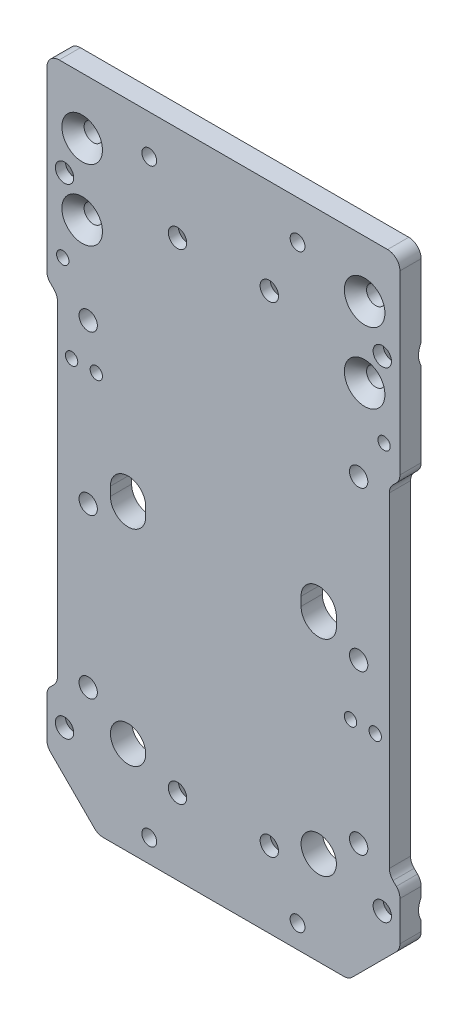
from build123d import *

# Parameters (mm, degrees)
BODY_DEPTH                                 = 3
REDUCESOMEWIDTH_DEPTH                      = 178.302002245
SCREWHEADHOLECARRIAGEY_R                   = 5
CUTFOROTHERSCREWSHEADS_DEPTH               = 178.302002245
ENDMILLMINIMUMRADIUS_R                     = 3.5
F_3_5_3_5_CABLETIEHOLES_D                  = 3.5
F_4_2_4_2_KP8_HOLES1_D                     = 4.2
F_4_2_4_2_KP8_HOLES2_D                     = 4.2
F_4_2_4_2_KP8_HOLES2_CSINK_D               = 9.6
F_4_2_4_2_KP8_HOLES2_CSINK_ANGLE           = 90
F_5_2_5_2_MOUNTANGLECORNERHOLES_AT_2_COUNT = 2
F_5_2_5_2_MOUNTANGLECORNERHOLES_AT_2_PITCH = 20
F_5_2_5_2_MOUNTANGLECORNERHOLES_AT_3_COUNT = 2
F_5_2_5_2_MOUNTANGLECORNERHOLES_AT_3_PITCH = 80
F_5_2_5_2_MOUNTANGLECORNERHOLES_AT_4_COUNT = 2
F_5_2_5_2_MOUNTANGLECORNERHOLES_AT_4_PITCH = 82.462112512
F_5_2_5_2_SK8_MOUNT_HOLES_D                = 5.2
F_5_2_5_2_SK8_MOUNT_HOLES_CSINK_D          = 11.5
F_5_2_5_2_SK8_MOUNT_HOLES_CSINK_ANGLE      = 90
F_3_5_3_5_ENDSENSORSHOLES_D                = 3.5
F_3_5_3_5_ENDSENSORSHOLES_CSINK_D          = 6.5
F_3_5_3_5_ENDSENSORSHOLES_CSINK_ANGLE      = 90
F_5_2_5_2_MOUNTTOBASEHOLES_D               = 5.2


with BuildPart() as part:
    # Sketch1 → Body (new, symmetric)
    with BuildSketch(Plane.XY):
        Polygon((35.5, -14.5), (50, 0), (50, 170), (-50, 170), (-50, 0), (-35.5, -14.5), align=None)
    extrude(amount=BODY_DEPTH, both=True)

    # Sketch6 → ReduceSomeWidth (cut, through all)
    with BuildSketch(Plane.XY.offset(3)):
        Polygon((-50, 115), (-47, 112), (-47, 17), (-50, 14), align=None)
        Polygon((50, 115), (47, 112), (47, 17), (50, 14), align=None)
    extrude(amount=-REDUCESOMEWIDTH_DEPTH, mode=Mode.SUBTRACT)

    # screwHeadHoleCarriageY → CutForOtherScrewsHeads (cut, through all)
    with BuildSketch(Plane(origin=(0, 0, -3), x_dir=(-1, 0, 0), z_dir=(0, 0, -1))):
        with Locations((-27, 12)):
            Circle(SCREWHEADHOLECARRIAGEY_R)
        with Locations((27, 12)):
            Circle(SCREWHEADHOLECARRIAGEY_R)
        with BuildLine():
            Line((-32, 70.2), (-32, 72.7))
            ThreePointArc((-32, 72.7), (-27, 77.7), (-22, 72.7))
            Line((-22, 72.7), (-22, 70.2))
            ThreePointArc((-22, 70.2), (-27, 65.2), (-32, 70.2))
        make_face()
        with BuildLine():
            Line((22, 70.2), (22, 72.7))
            ThreePointArc((22, 72.7), (27, 77.7), (32, 72.7))
            Line((32, 72.7), (32, 70.2))
            ThreePointArc((32, 70.2), (27, 65.2), (22, 70.2))
        make_face()
    extrude(amount=-CUTFOROTHERSCREWSHEADS_DEPTH, mode=Mode.SUBTRACT)

    # EndMillMinimumRadius
    endmillminimumradius_edges = [part.edges().sort_by_distance(p)[0] for p in [
        (-50, 170, 0),
        (50, 170, 0),
        (47, 112, 0),
        (47, 17, 0),
        (-47, 17, 0),
        (-47, 112, 0),
        (-50, 14, 0),
        (-50, 0, 0),
        (-35.5, -14.5, 0),
        (50, 14, 0),
        (50, 0, 0),
        (35.5, -14.5, 0),
        (-50, 115, 0),
        (50, 115, 0),
    ]]
    fillet(endmillminimumradius_edges, radius=ENDMILLMINIMUMRADIUS_R)

    # Ø3.5 (3.5) CableTieHoles (through all)
    with Locations(Plane(origin=(0, 0, -3), x_dir=(-1, 0, 0), z_dir=(0, 0, -1))):
        with Locations((-45.5, 122), (45.5, 122)):
            Hole(F_3_5_3_5_CABLETIEHOLES_D / 2)

    # Ø4.2 (4.2) KP8 Holes1 (through all)
    with Locations(Plane(origin=(0, 0, -3), x_dir=(-1, 0, 0), z_dir=(0, 0, -1))):
        with Locations((-21, 159), (21, 159)):
            Hole(F_4_2_4_2_KP8_HOLES1_D / 2)

    # Ø4.2 (4.2) KP8 Holes2 (through all)
    with Locations(Plane(origin=(0, 0, -3), x_dir=(-1, 0, 0), z_dir=(0, 0, -1))):
        with Locations((-21, -8), (21, -8)):
            CounterSinkHole(F_4_2_4_2_KP8_HOLES2_D / 2, F_4_2_4_2_KP8_HOLES2_CSINK_D / 2, counter_sink_angle=F_4_2_4_2_KP8_HOLES2_CSINK_ANGLE)

    # Sketch16 → Ø5.2 (5.2) MountAngleCornerHoles (revolve, cut)
    with BuildSketch(Plane(origin=(40, 154, -3), x_dir=(0, 1, 0), z_dir=(1, 0, 0))):
        Polygon((0, 0), (0, 6), (5.75, 6), (2.6, 2.85), (2.6, 0), align=None)
    f_5_2_5_2_mountanglecornerholes = revolve(axis=Axis((40, 154, -9.35), (0, 0, 1)), mode=Mode.SUBTRACT)

    # Ø5.2 (5.2) MountAngleCornerHoles at 2: Ø5.2 (5.2) MountAngleCornerHoles ×2
    with Locations(*[(0, -i * F_5_2_5_2_MOUNTANGLECORNERHOLES_AT_2_PITCH, 0) for i in range(1, F_5_2_5_2_MOUNTANGLECORNERHOLES_AT_2_COUNT)]):
        add(f_5_2_5_2_mountanglecornerholes, mode=Mode.SUBTRACT)

    # Ø5.2 (5.2) MountAngleCornerHoles at 3: Ø5.2 (5.2) MountAngleCornerHoles ×2
    with Locations(*[(-i * F_5_2_5_2_MOUNTANGLECORNERHOLES_AT_3_PITCH, 0, 0) for i in range(1, F_5_2_5_2_MOUNTANGLECORNERHOLES_AT_3_COUNT)]):
        add(f_5_2_5_2_mountanglecornerholes, mode=Mode.SUBTRACT)

    # Ø5.2 (5.2) MountAngleCornerHoles at 4: Ø5.2 (5.2) MountAngleCornerHoles ×2
    with Locations(*[Vector(-0.9701425001453319, -0.24253562503633297, 0) * (i * F_5_2_5_2_MOUNTANGLECORNERHOLES_AT_4_PITCH) for i in range(1, F_5_2_5_2_MOUNTANGLECORNERHOLES_AT_4_COUNT)]):
        add(f_5_2_5_2_mountanglecornerholes, mode=Mode.SUBTRACT)

    # Ø5.2 (5.2) SK8 Mount Holes (through all)
    with Locations(Plane(origin=(0, 0, -3), x_dir=(-1, 0, 0), z_dir=(0, 0, -1))):
        with Locations((-45, 143.1), (-13, 143.1), (13, 143.1), (45, 143.1), (-45, 7), (-13, 7), (13, 7), (45, 7)):
            CounterSinkHole(F_5_2_5_2_SK8_MOUNT_HOLES_D / 2, F_5_2_5_2_SK8_MOUNT_HOLES_CSINK_D / 2, counter_sink_angle=F_5_2_5_2_SK8_MOUNT_HOLES_CSINK_ANGLE)

    # Ø3.5 (3.5) EndSensorsHoles (through all)
    with Locations(Plane(origin=(0, 0, -3), x_dir=(-1, 0, 0), z_dir=(0, 0, -1))):
        with Locations((-43, 49.5), (-36, 49.5), (36, 98.5), (43, 98.5)):
            CounterSinkHole(F_3_5_3_5_ENDSENSORSHOLES_D / 2, F_3_5_3_5_ENDSENSORSHOLES_CSINK_D / 2, counter_sink_angle=F_3_5_3_5_ENDSENSORSHOLES_CSINK_ANGLE)

    # Ø5.2 (5.2) MountToBaseHoles (through all)
    with Locations(Plane.XY.offset(3)):
        with Locations((-38.3, 110.2), (-38.3, 65.2), (-38.3, 20.2), (38.3, 20.2), (38.3, 65.2), (38.3, 110.2)):
            Hole(F_5_2_5_2_MOUNTTOBASEHOLES_D / 2)


solid = part.part
